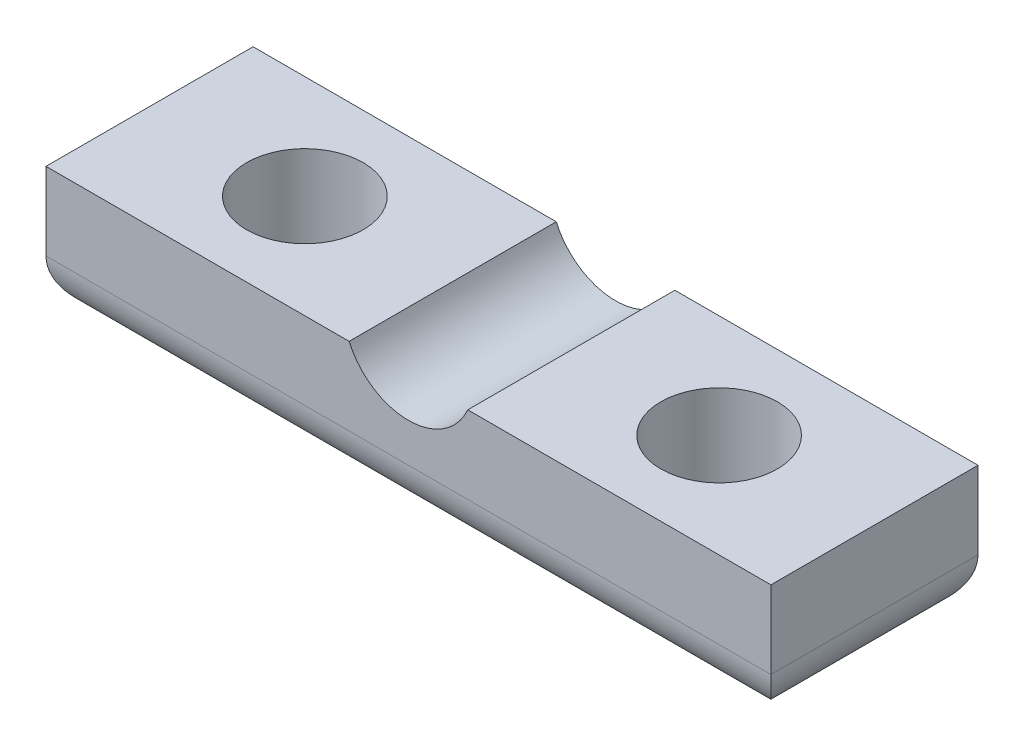
from build123d import *

# Parameters (mm, degrees)
SKETCH1_W           = 28
SKETCH1_H           = 8
SKETCH1_R           = 2.25
BOSS_EXTRUDE1_DEPTH = 5
CUT_EXTRUDE1_REACH  = 31.547
FILLET1_R           = 2


with BuildPart() as part:
    # Sketch1 → Boss-Extrude1 (new body)
    with BuildSketch(Plane(origin=(0, 0, 0), x_dir=(1, 0, 0), z_dir=(0, 1, 0))):
        with Locations((14, 4)):
            Rectangle(SKETCH1_W, SKETCH1_H)
        with Locations(Location((6, 4, 0), (0, 0, 270))):
            Circle(SKETCH1_R, mode=Mode.SUBTRACT)
        with Locations(Location((22, 4, 0), (0, 0, 270))):
            Circle(SKETCH1_R, mode=Mode.SUBTRACT)
    extrude(amount=BOSS_EXTRUDE1_DEPTH)

    # Sketch2 → Cut-Extrude1 (cut, up to next)
    with BuildSketch(Plane.XY, mode=Mode.PRIVATE) as cut_extrude1_sk1:
        with BuildLine():
            Line((11.5, 6), (16.5, 6))
            ThreePointArc((16.5, 6), (14, 3.5), (11.5, 6))
        make_face()
    cut_extrude1_tool1 = extrude(cut_extrude1_sk1.sketch, amount=-CUT_EXTRUDE1_REACH, mode=Mode.PRIVATE) & part.part
    add(cut_extrude1_tool1.solids().sort_by_distance((14, 4.938967, 0))[0], mode=Mode.SUBTRACT)

    # Fillet1
    # the kernel refuses this fillet: 2 mm, written as the material it takes off along each edge
    with BuildSketch(Plane(origin=(-5, 0, -8), x_dir=(0, 1, 0), z_dir=(1, 0, 0))) as fillet1_piece_1:
        with BuildLine():
            CenterArc((FILLET1_R, FILLET1_R), FILLET1_R, 180, 90)
            Line((0, FILLET1_R), (0, 0))
            Line((0, 0), (FILLET1_R, 0))
        make_face()
    extrude(amount=38, mode=Mode.SUBTRACT)
    with BuildSketch(Plane(origin=(28, 0, -13), x_dir=(-1, 0, 0), z_dir=(0, 0, 1)), Plane(origin=(0, 0, 5), x_dir=(1, 0, 0), z_dir=(0, 0, -1))) as fillet1_piece_2:
        with BuildLine():
            CenterArc((FILLET1_R, -FILLET1_R), FILLET1_R, 90, 90)
            Line((0, -FILLET1_R), (0, 0))
            Line((0, 0), (FILLET1_R, 0))
        make_face()
    extrude(amount=18, mode=Mode.SUBTRACT)
    with BuildSketch(Plane(origin=(33, 0, 0), x_dir=(0, 0, -1), z_dir=(-1, 0, 0))) as fillet1_piece_3:
        with BuildLine():
            CenterArc((FILLET1_R, -FILLET1_R), FILLET1_R, 90, 90)
            Line((0, -FILLET1_R), (0, 0))
            Line((0, 0), (FILLET1_R, 0))
        make_face()
    extrude(amount=38, mode=Mode.SUBTRACT)


solid = part.part
